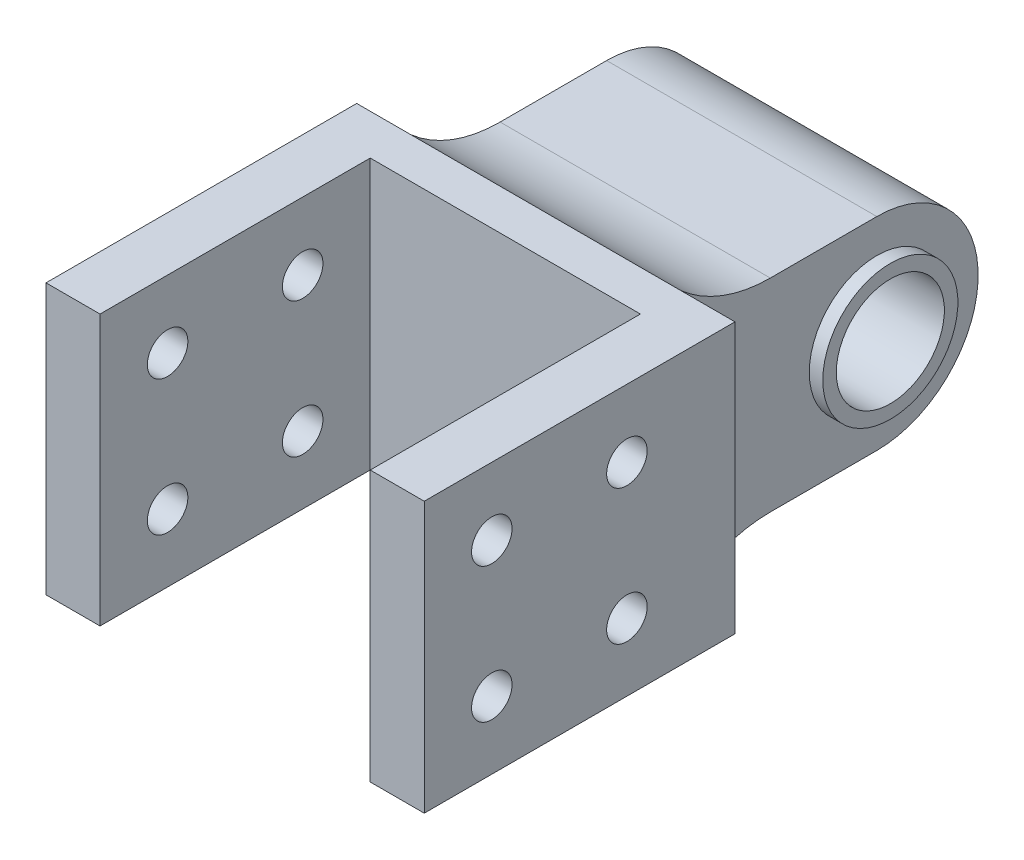
from build123d import *
from build123d.topology import SkipClean

# Parameters (mm, degrees)
SKETCH_1_W          = 28
SKETCH_1_H          = 20
EXTRUDE_1_DEPTH     = 20
SKETCH_3_W          = 28
SKETCH_3_H          = 20
EXTRUDE_2_DEPTH     = 3
SKETCH_4_R          = 4
EXTRUDE_3_DEPTH     = 10
EXTRUDE_START       = 1
SKETCH_5_R          = 5
SKETCH_5_R_2        = 4
EXTRUDE_4_DEPTH     = 1
FILLET_1_R          = 10
SKETCH_11_W         = 20
SKETCH_11_H         = 20
CUT_EXTRUDE_1_DEPTH = 20
SKETCH_12_R         = 1.5
CUT_EXTRUDE_2_DEPTH = 40


with BuildPart() as part:
    # 草图1 → 凸台-拉伸1 (new body)
    with BuildSketch(Plane.XY):
        Rectangle(SKETCH_1_W, SKETCH_1_H)
    extrude(amount=EXTRUDE_1_DEPTH)

    # 草图3 → 凸台-拉伸2 (add)
    with BuildSketch(Plane(origin=(0, 0, 0), x_dir=(-1, 0, 0), z_dir=(0, 0, -1))):
        Rectangle(SKETCH_3_W, SKETCH_3_H)
    extrude(amount=EXTRUDE_2_DEPTH)

    # 草图4 → 凸台-拉伸3 (add, symmetric)
    with BuildSketch(Plane(origin=(0, 0, 0), x_dir=(0, 0, -1), z_dir=(1, 0, 0))):
        with BuildLine():
            Line((17.5, 7.5), (3, 7.5))
            Line((3, 7.5), (3, -7.5))
            Line((3, -7.5), (17.5, -7.5))
            ThreePointArc((17.5, -7.5), (25, 0), (17.5, 7.5))
        make_face()
        with Locations((17.5, 0)):
            Circle(SKETCH_4_R, mode=Mode.SUBTRACT)
    extrude(amount=EXTRUDE_3_DEPTH, both=True)

    # 草图5 → 凸台-拉伸4 (add)
    with SkipClean():  # the faces are left unmerged after this step: merging them gives an invalid solid
        with BuildSketch(Plane.ZY.offset(10).offset(EXTRUDE_START)):
            with Locations(Location((-17.5, 0, 0), (0, 0, 180))):
                Circle(SKETCH_5_R)
            with Locations((-17.5, 0)):
                Circle(SKETCH_5_R_2, mode=Mode.SUBTRACT)
        extrude_4 = extrude(amount=-EXTRUDE_4_DEPTH)

    # 镜向1: 凸台-拉伸4 across plane
    add(extrude_4.mirror(Plane(origin=(0, 0, 0), x_dir=(0, 0, 1), z_dir=(1, 0, 0))))

    # 圆角1
    # the kernel refuses this fillet: 10 mm, written as the material it adds along each edge
    with BuildSketch(Plane(origin=(-10, 7.5, -3), x_dir=(0, 1, 0), z_dir=(1, 0, 0)), Plane(origin=(10, -7.5, -3), x_dir=(0, -1, 0), z_dir=(-1, 0, 0))) as fillet_1_piece_1:
        with BuildLine():
            CenterArc((10, -6.614378278), FILLET_1_R, 138.590377891, 41.409622109)
            Line((0, -6.614378278), (-0.2, -6.614378278))
            Line((-0.2, -6.614378278), (-0.2, 0))
            Line((-0.2, 0), (0, 0.2))
            ThreePointArc((0, 0.2), (1.25, 0.2), (2.35, 0.132287566))
            Line((2.35, 0.132287566), (2.5, 0))
        make_face()
    extrude(amount=20)

    # 草图11 → 切除-拉伸1 (cut)
    with BuildSketch(Plane.XZ.offset(10)):
        with Locations((0, 10)):
            Rectangle(SKETCH_11_W, SKETCH_11_H)
    extrude(amount=-CUT_EXTRUDE_1_DEPTH, mode=Mode.SUBTRACT)

    # 草图12 → 切除-拉伸2 (cut)
    with BuildSketch(Plane(origin=(14, 0, 0), x_dir=(0, 0, -1), z_dir=(1, 0, 0))):
        with Locations((-15, 5)):
            Circle(SKETCH_12_R)
        with Locations((-5, 5)):
            Circle(SKETCH_12_R)
        with Locations((-5, -5)):
            Circle(SKETCH_12_R)
        with Locations((-15, -5)):
            Circle(SKETCH_12_R)
    extrude(amount=-CUT_EXTRUDE_2_DEPTH, mode=Mode.SUBTRACT)


solid = part.part
